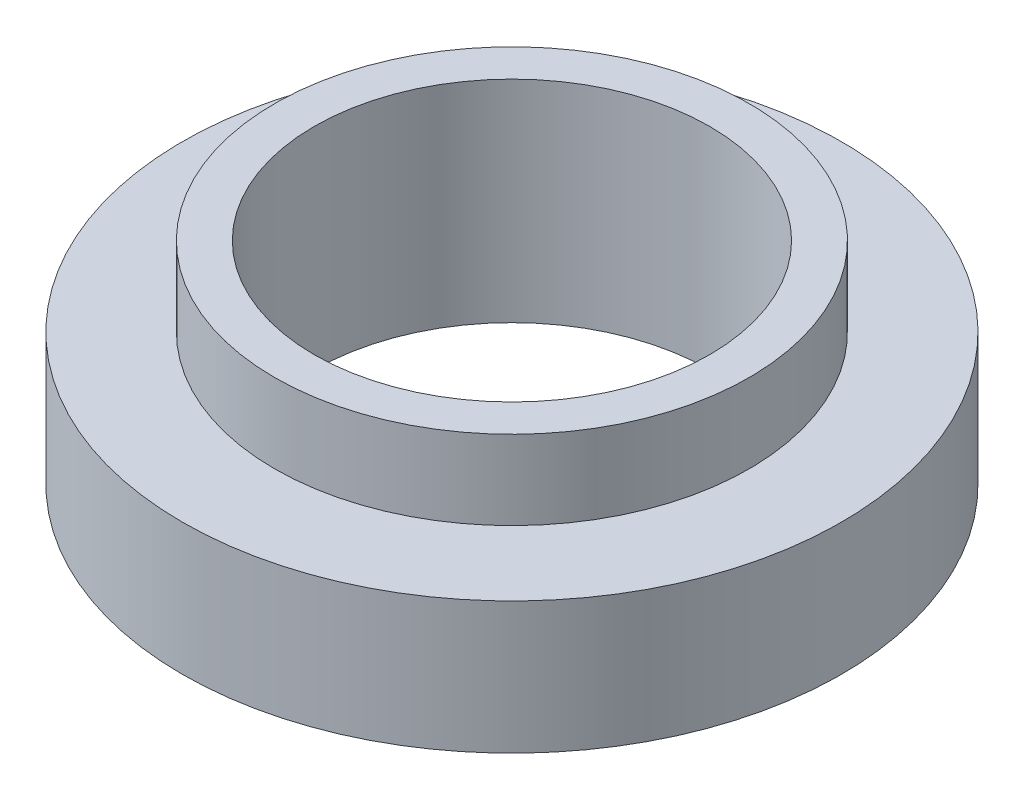
from build123d import *

# Parameters (mm, degrees)
SKETCH1_R           = 12.5
BOSS_EXTRUDE1_DEPTH = 5
SKETCH2_R           = 9
BOSS_EXTRUDE2_DEPTH = 3
SKETCH3_R           = 7.5
CUT_EXTRUDE1_DEPTH  = 13


with BuildPart() as part:
    # Sketch1 → Boss-Extrude1 (new body)
    with BuildSketch(Plane(origin=(0, 0, 0), x_dir=(1, 0, 0), z_dir=(0, 1, 0))):
        Circle(SKETCH1_R)
    extrude(amount=BOSS_EXTRUDE1_DEPTH)

    # Sketch2 → Boss-Extrude2 (add)
    with BuildSketch(Plane(origin=(0, 5, 0), x_dir=(1, 0, 0), z_dir=(0, 1, 0))):
        Circle(SKETCH2_R)
    extrude(amount=BOSS_EXTRUDE2_DEPTH)

    # Sketch3 → Cut-Extrude1 (cut)
    with BuildSketch(Plane(origin=(0, 8, 0), x_dir=(1, 0, 0), z_dir=(0, 1, 0))):
        Circle(SKETCH3_R)
    extrude(amount=-CUT_EXTRUDE1_DEPTH, mode=Mode.SUBTRACT)


solid = part.part
